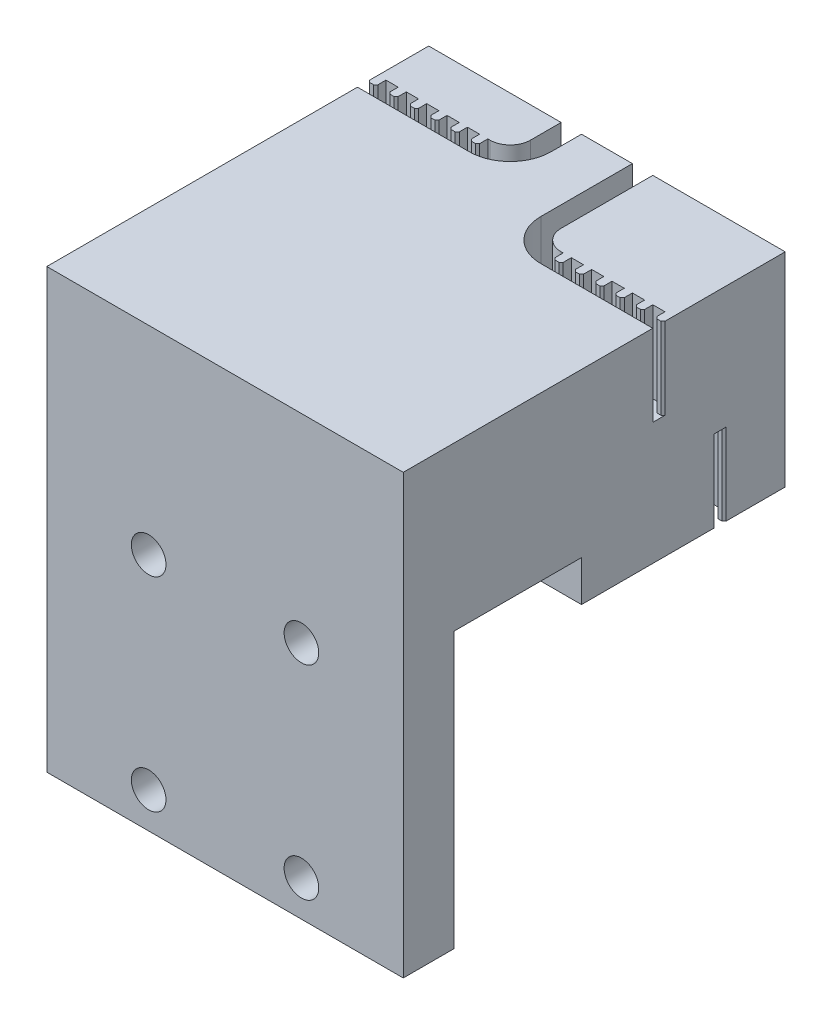
from build123d import *

# Parameters (mm, degrees)
SKETCH1_W           = 35
SKETCH1_H           = 20
BOSS_EXTRUDE1_DEPTH = 20
CUT_EXTRUDE1_DEPTH  = 8
CUT_EXTRUDE2_DEPTH  = 8
BOSS_EXTRUDE2_DEPTH = 8
BOSS_EXTRUDE4_DEPTH = 8
SKETCH9_W           = 35
SKETCH9_H           = 16
BOSS_EXTRUDE5_DEPTH = 12.5
SKETCH11_W          = 35
SKETCH11_H          = 43
BOSS_EXTRUDE6_DEPTH = 5
SKETCH12_R          = 1.7
CUT_EXTRUDE3_DEPTH  = 5


with BuildPart() as part:
    # Sketch1 → Boss-Extrude1 (new body)
    with BuildSketch(Plane(origin=(0, 0, 0), x_dir=(1, 0, 0), z_dir=(0, 1, 0))):
        with Locations((17.5, 10)):
            Rectangle(SKETCH1_W, SKETCH1_H)
    extrude(amount=BOSS_EXTRUDE1_DEPTH)

    # Sketch2 → Cut-Extrude1 (cut)
    with BuildSketch(Plane(origin=(0, 20, 0), x_dir=(1, 0, 0), z_dir=(0, 1, 0))):
        with BuildLine():
            Line((0, 13), (11, 13))
            ThreePointArc((11, 13), (13.828427125, 14.171572875), (15, 17))
            Line((15, 17), (15, 20))
            Line((15, 20), (13, 20))
            Line((13, 20), (13, 17))
            ThreePointArc((13, 17), (12.414213562, 15.585786438), (11, 15))
            Line((11, 15), (0, 15))
            Line((0, 15), (0, 13))
        make_face()
        with BuildLine():
            Line((35, 7), (24, 7))
            ThreePointArc((24, 7), (21.171572875, 8.171572875), (20, 11))
            Line((20, 11), (20, 20))
            Line((20, 20), (22, 20))
            Line((22, 20), (22, 11))
            ThreePointArc((22, 11), (22.585786438, 9.585786438), (24, 9))
            Line((24, 9), (35, 9))
            Line((35, 9), (35, 7))
        make_face()
    extrude(amount=-CUT_EXTRUDE1_DEPTH, mode=Mode.SUBTRACT)

    # Sketch5 → Cut-Extrude2 (cut)
    with BuildSketch(Plane(origin=(0, 0, 0), x_dir=(-1, 0, 0), z_dir=(0, -1, 0))):
        with BuildLine():
            Line((-35, 13), (-24, 13))
            ThreePointArc((-24, 13), (-21.171572875, 14.171572875), (-20, 17))
            Line((-20, 17), (-20, 20))
            Line((-20, 20), (-22, 20))
            Line((-22, 20), (-22, 17))
            ThreePointArc((-22, 17), (-22.585786438, 15.585786438), (-24, 15))
            Line((-24, 15), (-35, 15))
            Line((-35, 15), (-35, 13))
        make_face()
        with BuildLine():
            Line((0, 7), (-11, 7))
            ThreePointArc((-11, 7), (-13.828427125, 8.171572875), (-15, 11))
            Line((-15, 11), (-15, 20))
            Line((-15, 20), (-13, 20))
            Line((-13, 20), (-13, 11))
            ThreePointArc((-13, 11), (-12.414213562, 9.585786438), (-11, 9))
            Line((-11, 9), (0, 9))
            Line((0, 9), (0, 7))
        make_face()
    extrude(amount=-CUT_EXTRUDE2_DEPTH, mode=Mode.SUBTRACT)

    # Sketch6 → Boss-Extrude2 (add)
    with BuildSketch(Plane(origin=(0, 20, 0), x_dir=(1, 0, 0), z_dir=(0, 1, 0))):
        Polygon((0.2, 14), (0, 14.2), (0, 15), (0.8, 15), (0.8, 14.2), (0.6, 14), align=None)
        Polygon((2.2, 14), (2, 14.2), (2, 15), (2.8, 15), (2.8, 14.2), (2.6, 14), align=None)
        Polygon((4.2, 14), (4, 14.2), (4, 15), (4.8, 15), (4.8, 14.2), (4.6, 14), align=None)
        Polygon((6.2, 14), (6, 14.2), (6, 15), (6.8, 15), (6.8, 14.2), (6.6, 14), align=None)
        Polygon((8.2, 14), (8, 14.2), (8, 15), (8.8, 15), (8.8, 14.2), (8.6, 14), align=None)
        Polygon((10.2, 14), (10, 14.2), (10, 15), (10.8, 15), (10.8, 14.2), (10.6, 14), align=None)
        Polygon((34.4, 8), (34.2, 8.2), (34.2, 9), (35, 9), (35, 8.2), (34.8, 8), align=None)
        Polygon((32.4, 8), (32.2, 8.2), (32.2, 9), (33, 9), (33, 8.2), (32.8, 8), align=None)
        Polygon((30.4, 8), (30.2, 8.2), (30.2, 9), (31, 9), (31, 8.2), (30.8, 8), align=None)
        Polygon((28.4, 8), (28.2, 8.2), (28.2, 9), (29, 9), (29, 8.2), (28.8, 8), align=None)
        Polygon((26.4, 8), (26.2, 8.2), (26.2, 9), (27, 9), (27, 8.2), (26.8, 8), align=None)
        Polygon((24.4, 8), (24.2, 8.2), (24.2, 9), (25, 9), (25, 8.2), (24.8, 8), align=None)
    extrude(amount=-BOSS_EXTRUDE2_DEPTH)

    # Sketch8 → Boss-Extrude4 (add)
    with BuildSketch(Plane.XZ):
        Polygon((34.8, -14), (35, -14.2), (35, -15), (34.2, -15), (34.2, -14.2), (34.4, -14), align=None)
        Polygon((32.8, -14), (33, -14.2), (33, -15), (32.2, -15), (32.2, -14.2), (32.4, -14), align=None)
        Polygon((30.8, -14), (31, -14.2), (31, -15), (30.2, -15), (30.2, -14.2), (30.4, -14), align=None)
        Polygon((28.8, -14), (29, -14.2), (29, -15), (28.2, -15), (28.2, -14.2), (28.4, -14), align=None)
        Polygon((26.8, -14), (27, -14.2), (27, -15), (26.2, -15), (26.2, -14.2), (26.4, -14), align=None)
        Polygon((24.8, -14), (25, -14.2), (25, -15), (24.2, -15), (24.2, -14.2), (24.4, -14), align=None)
        Polygon((0.8, -8.2), (0.6, -8), (0.2, -8), (0, -8.2), (0, -9), (0.8, -9), align=None)
        Polygon((2.8, -8.2), (2.6, -8), (2.2, -8), (2, -8.2), (2, -9), (2.8, -9), align=None)
        Polygon((4.8, -8.2), (4.6, -8), (4.2, -8), (4, -8.2), (4, -9), (4.8, -9), align=None)
        Polygon((6.8, -8.2), (6.6, -8), (6.2, -8), (6, -8.2), (6, -9), (6.8, -9), align=None)
        Polygon((8.8, -8.2), (8.6, -8), (8.2, -8), (8, -8.2), (8, -9), (8.8, -9), align=None)
        Polygon((10.8, -8.2), (10.6, -8), (10.2, -8), (10, -8.2), (10, -9), (10.8, -9), align=None)
    extrude(amount=-BOSS_EXTRUDE4_DEPTH)

    # Sketch9 → Boss-Extrude5 (add)
    with BuildSketch(Plane.XY):
        with Locations((17.5, 12)):
            Rectangle(SKETCH9_W, SKETCH9_H)
    extrude(amount=BOSS_EXTRUDE5_DEPTH)

    # Sketch11 → Boss-Extrude6 (add)
    with BuildSketch(Plane.XY.offset(12.5)):
        with Locations((17.5, -1.5)):
            Rectangle(SKETCH11_W, SKETCH11_H)
    extrude(amount=BOSS_EXTRUDE6_DEPTH)

    # Sketch12 → Cut-Extrude3 (cut)
    with BuildSketch(Plane.XY.offset(17.5)):
        with Locations((10, 0.5)):
            Circle(SKETCH12_R)
        with Locations((25, 0.5)):
            Circle(SKETCH12_R)
        with Locations((25, -19.5)):
            Circle(SKETCH12_R)
        with Locations((10, -19.5)):
            Circle(SKETCH12_R)
    extrude(amount=-CUT_EXTRUDE3_DEPTH, mode=Mode.SUBTRACT)


solid = part.part
